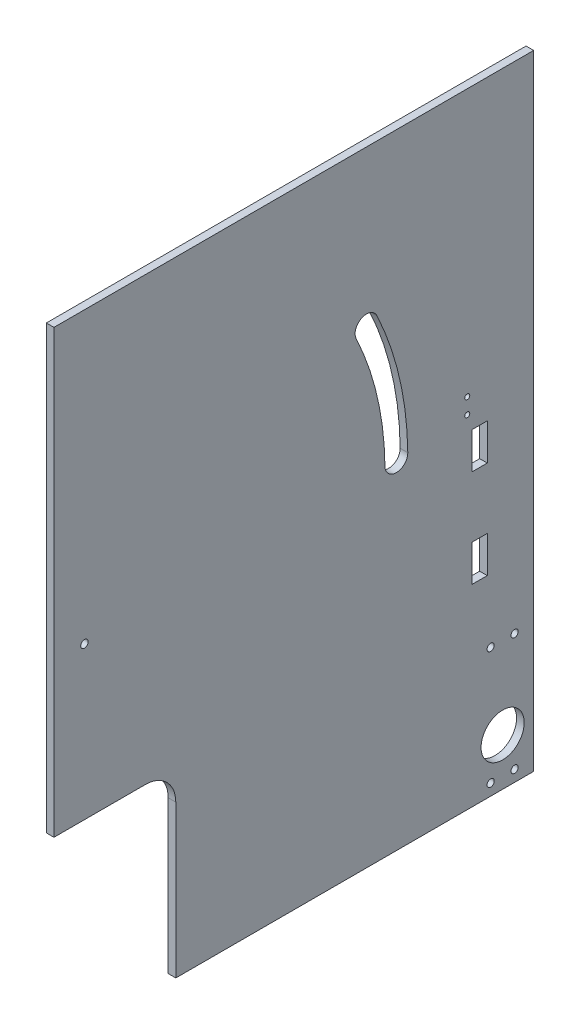
from build123d import *

# Parameters (mm, degrees)
SKETCH1_W           = 200.025
SKETCH1_H           = 260.35
BOSS_EXTRUDE1_DEPTH = 3.175
SKETCH8_R           = 1.55
SKETCH8_R_2         = 1.0499979
CUT_EXTRUDE7_DEPTH  = 165.189254844
SKETCH9_W           = 50.8
SKETCH9_H           = 76.2
CUT_EXTRUDE8_DEPTH  = 165.189254844
FILLET1_R           = 12.7
CUT_EXTRUDE9_DEPTH  = 165.189254844
SKETCH15_W          = 6.35
SKETCH15_H          = 15.24
CUT_EXTRUDE12_DEPTH = 165.189254844
SKETCH16_R          = 1.5
SKETCH16_R_2        = 9
CUT_EXTRUDE13_DEPTH = 165.189254844


with BuildPart() as part:
    # Sketch1 → Boss-Extrude1 (new body)
    with BuildSketch(Plane(origin=(0, 0, 0), x_dir=(0, 0, -1), z_dir=(1, 0, 0))):
        Rectangle(SKETCH1_W, SKETCH1_H)
    extrude(amount=BOSS_EXTRUDE1_DEPTH)

    # Sketch8 → Cut-Extrude7 (cut, through all)
    with BuildSketch(Plane.ZY):
        with Locations((87.3125, 9.525)):
            Circle(SKETCH8_R)
        with Locations((-72.3175, 18.9250066)):
            Circle(SKETCH8_R_2)
        with Locations((-72.3175, 12.4249942)):
            Circle(SKETCH8_R_2)
    extrude(amount=-CUT_EXTRUDE7_DEPTH, mode=Mode.SUBTRACT)

    # Sketch9 → Cut-Extrude8 (cut, through all)
    with BuildSketch(Plane.ZY):
        with Locations((74.6125, -92.075)):
            Rectangle(SKETCH9_W, SKETCH9_H)
    extrude(amount=-CUT_EXTRUDE8_DEPTH, mode=Mode.SUBTRACT)

    # Fillet1
    fillet1_edges = [part.edges().sort_by_distance(p)[0] for p in [
        (1.5875, -53.975, 49.2125),
    ]]
    fillet(fillet1_edges, radius=FILLET1_R)

    # Sketch10 → Cut-Extrude9 (cut, through all)
    with BuildSketch(Plane.ZY):
        with BuildLine():
            ThreePointArc((-34.631218673, 67.095364965), (-44.09213985, 39.8142402), (-47.528128749, 11.144346963))
            ThreePointArc((-47.528128749, 11.144346963), (-42.823162504, 6.325000001), (-38.003815542, 11.029966247))
            ThreePointArc((-38.003815542, 11.029966247), (-34.810523806, 37.674794334), (-26.017864022, 63.028948034))
            ThreePointArc((-26.017864022, 63.028948034), (-28.291332832, 69.36883393), (-34.631218673, 67.095364965))
        make_face()
    extrude(amount=-CUT_EXTRUDE9_DEPTH, mode=Mode.SUBTRACT)

    # Sketch15 → Cut-Extrude12 (cut, through all)
    with BuildSketch(Plane(origin=(3.175, 0, 0), x_dir=(0, 0, -1), z_dir=(1, 0, 0))):
        with Locations((77.4925, -1.5450058)):
            Rectangle(SKETCH15_W, SKETCH15_H)
        with Locations((77.4925, -42.1850058)):
            Rectangle(SKETCH15_W, SKETCH15_H)
    extrude(amount=-CUT_EXTRUDE12_DEPTH, mode=Mode.SUBTRACT)

    # Sketch16 → Cut-Extrude13 (cut, through all)
    with BuildSketch(Plane(origin=(3.175, 0, 0), x_dir=(0, 0, -1), z_dir=(1, 0, 0))):
        with Locations((82.075, -125.4125)):
            Circle(SKETCH16_R)
        with Locations((82.075, -76.4125)):
            Circle(SKETCH16_R)
        with Locations((92.075, -125.4125)):
            Circle(SKETCH16_R)
        with Locations((92.075, -76.4125)):
            Circle(SKETCH16_R)
        with Locations((87.075, -110.5624916)):
            Circle(SKETCH16_R_2)
    extrude(amount=-CUT_EXTRUDE13_DEPTH, mode=Mode.SUBTRACT)


solid = part.part
